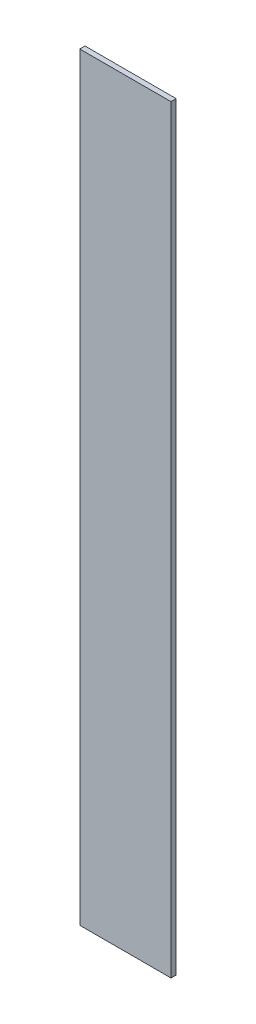
from build123d import *

# Parameters (mm, degrees)
SKETCH1_W           = 28
SKETCH1_H           = 233
BOSS_EXTRUDE1_DEPTH = 1.6


with BuildPart() as part:
    # Sketch1 → Boss-Extrude1 (new body)
    with BuildSketch(Plane.XY):
        with Locations((0, 116.5)):
            Rectangle(SKETCH1_W, SKETCH1_H)
    extrude(amount=BOSS_EXTRUDE1_DEPTH)


solid = part.part
